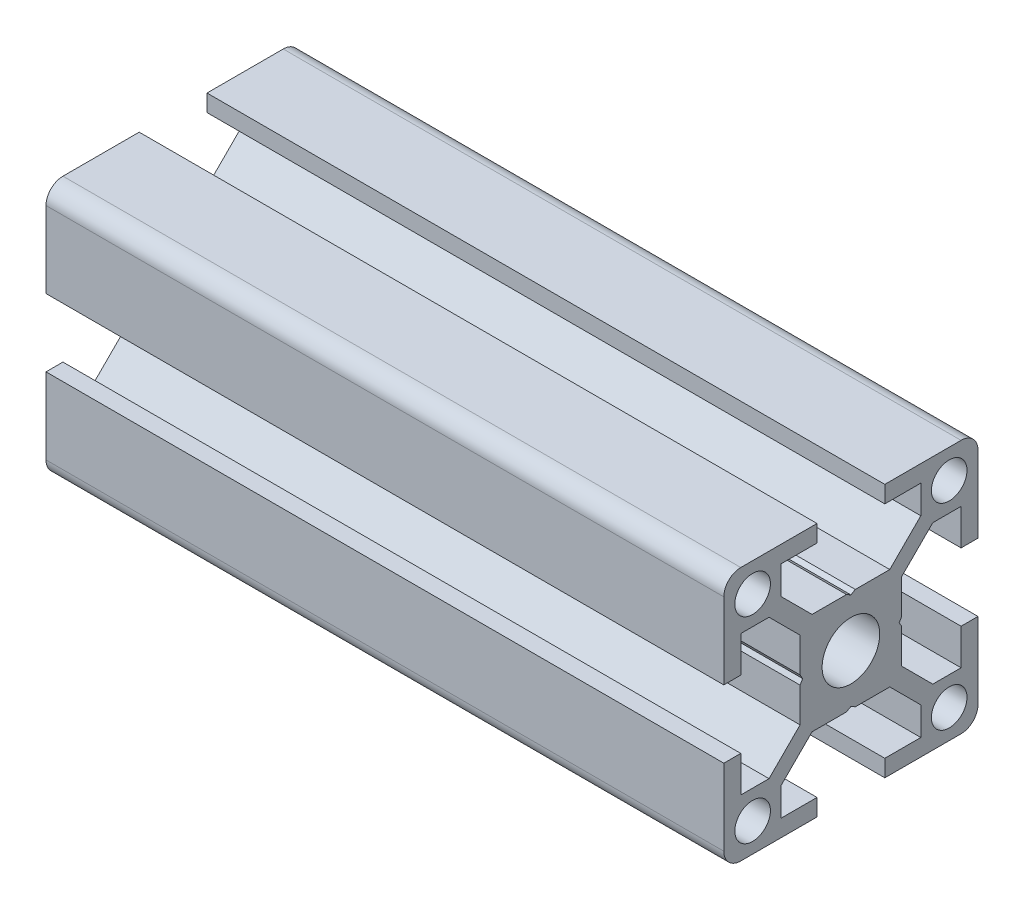
from build123d import *

# Parameters (mm, degrees)
SKETCH1_R           = 3.4
SKETCH1_R_2         = 2.1
BOSS_EXTRUDE1_DEPTH = 80


with BuildPart() as part:
    # Sketch1 → Boss-Extrude1 (new body)
    with BuildSketch(Plane(origin=(0, 0, 0), x_dir=(0, -1, 0), z_dir=(-1, 0, 0))):
        with BuildLine():
            Line((13, -4), (13, -8.25))
            Line((13, -8.25), (9.664213562, -8.25))
            Line((9.664213562, -8.25), (6, -4.585786438))
            Line((6, -4.585786438), (6, -0.519615242))
            Line((6, -0.519615242), (5.7, 0))
            Line((5.7, 0), (6, 0.519615242))
            Line((6, 0.519615242), (6, 4.585786438))
            Line((6, 4.585786438), (9.664213562, 8.25))
            Line((9.664213562, 8.25), (13, 8.25))
            Line((13, 8.25), (13, 4))
            Line((13, 4), (15, 4))
            Line((15, 4), (15, 13))
            ThreePointArc((15, 13), (14.414213562, 14.414213562), (13, 15))
            Line((13, 15), (4, 15))
            Line((4, 15), (4, 13))
            Line((4, 13), (8.25, 13))
            Line((8.25, 13), (8.25, 9.664213562))
            Line((8.25, 9.664213562), (4.585786438, 6))
            Line((4.585786438, 6), (0.519615242, 6))
            Line((0.519615242, 6), (0, 5.7))
            Line((0, 5.7), (-0.519615242, 6))
            Line((-0.519615242, 6), (-4.585786438, 6))
            Line((-4.585786438, 6), (-8.25, 9.664213562))
            Line((-8.25, 9.664213562), (-8.25, 13))
            Line((-8.25, 13), (-4, 13))
            Line((-4, 13), (-4, 15))
            Line((-4, 15), (-13, 15))
            ThreePointArc((-13, 15), (-14.414213562, 14.414213562), (-15, 13))
            Line((-15, 13), (-15, 4))
            Line((-15, 4), (-13, 4))
            Line((-13, 4), (-13, 8.25))
            Line((-13, 8.25), (-9.664213562, 8.25))
            Line((-9.664213562, 8.25), (-6, 4.585786438))
            Line((-6, 4.585786438), (-6, 0.519615242))
            Line((-6, 0.519615242), (-5.7, 0))
            Line((-5.7, 0), (-6, -0.519615242))
            Line((-6, -0.519615242), (-6, -4.585786438))
            Line((-6, -4.585786438), (-9.664213562, -8.25))
            Line((-9.664213562, -8.25), (-13, -8.25))
            Line((-13, -8.25), (-13, -4))
            Line((-13, -4), (-15, -4))
            Line((-15, -4), (-15, -13))
            ThreePointArc((-15, -13), (-14.414213562, -14.414213562), (-13, -15))
            Line((-13, -15), (-4, -15))
            Line((-4, -15), (-4, -13))
            Line((-4, -13), (-8.25, -13))
            Line((-8.25, -13), (-8.25, -9.664213562))
            Line((-8.25, -9.664213562), (-4.585786438, -6))
            Line((-4.585786438, -6), (-0.519615242, -6))
            Line((-0.519615242, -6), (0, -5.7))
            Line((0, -5.7), (0.519615242, -6))
            Line((0.519615242, -6), (4.585786438, -6))
            Line((4.585786438, -6), (8.25, -9.664213562))
            Line((8.25, -9.664213562), (8.25, -13))
            Line((8.25, -13), (4, -13))
            Line((4, -13), (4, -15))
            Line((4, -15), (13, -15))
            ThreePointArc((13, -15), (14.414213562, -14.414213562), (15, -13))
            Line((15, -13), (15, -4))
            Line((15, -4), (13, -4))
        make_face()
        Circle(SKETCH1_R, mode=Mode.SUBTRACT)
        with Locations((11.6, -11.6)):
            Circle(SKETCH1_R_2, mode=Mode.SUBTRACT)
        with Locations((11.6, 11.6)):
            Circle(SKETCH1_R_2, mode=Mode.SUBTRACT)
        with Locations((-11.6, 11.6)):
            Circle(SKETCH1_R_2, mode=Mode.SUBTRACT)
        with Locations((-11.6, -11.6)):
            Circle(SKETCH1_R_2, mode=Mode.SUBTRACT)
    extrude(amount=-BOSS_EXTRUDE1_DEPTH)


solid = part.part
